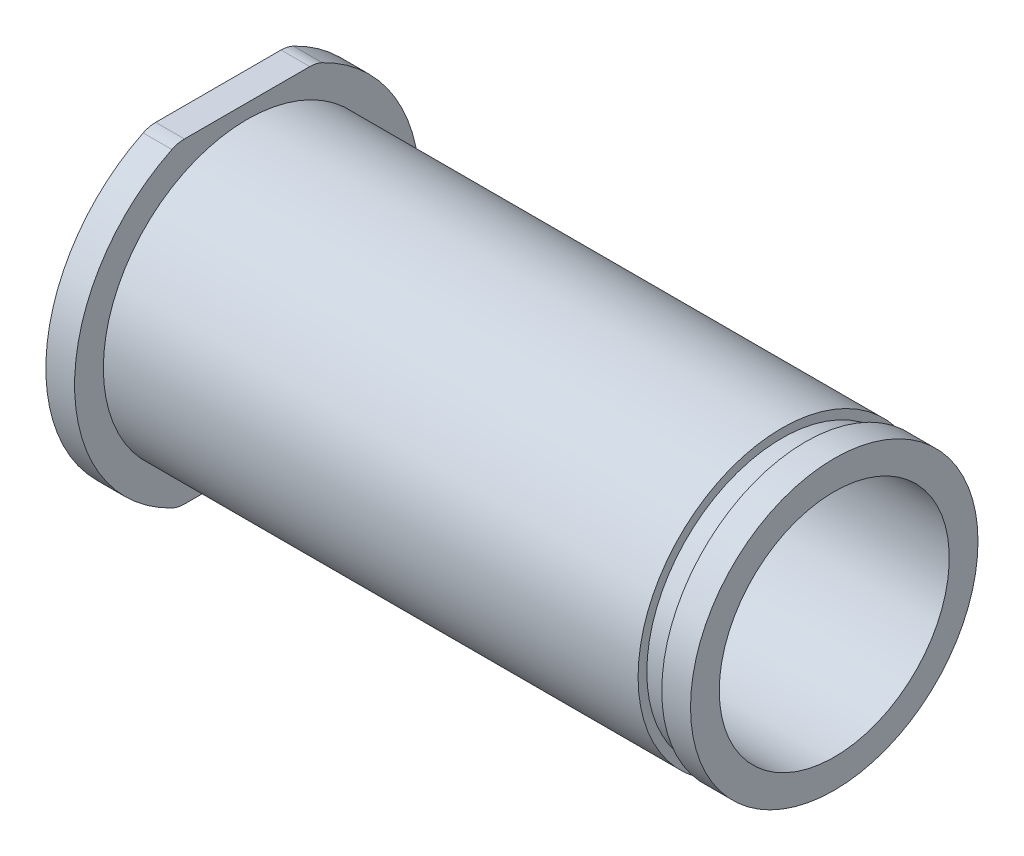
from build123d import *

# Parameters (mm, degrees)
SKETCH2_W          = 15.226765086
SKETCH2_H          = 1.5875
CUT_EXTRUDE1_DEPTH = 74.162071112
FILLET1_R          = 3.175


with BuildPart() as part:
    # Sketch1 → Revolve1 (revolve)
    with BuildSketch(Plane.XY):
        Polygon((0, 19.05), (0, 12.7), (68.0212, 12.7), (68.0212, 15.875), (64.8462, 15.875), (64.8462, 14.9098), (62.23, 14.9098), (62.23, 15.875), (3.175, 15.875), (3.175, 19.05), align=None)
    revolve(axis=Axis((0, 0, 0), (1, 0, 0)))

    # Sketch2 → Cut-Extrude1 (cut, through all)
    with BuildSketch(Plane.ZY):
        with Locations((0, 18.25625)):
            Rectangle(SKETCH2_W, SKETCH2_H)
        with Locations((0, -18.25625)):
            Rectangle(SKETCH2_W, SKETCH2_H)
    extrude(amount=-CUT_EXTRUDE1_DEPTH, mode=Mode.SUBTRACT)

    # Fillet1
    fillet1_edges = [part.edges().sort_by_distance(p)[0] for p in [
        (1.5875, -17.4625, -7.613382543),
        (1.5875, -17.4625, 7.613382543),
        (1.5875, 17.4625, 7.613382543),
        (1.5875, 17.4625, -7.613382543),
    ]]
    fillet(fillet1_edges, radius=FILLET1_R)


solid = part.part
